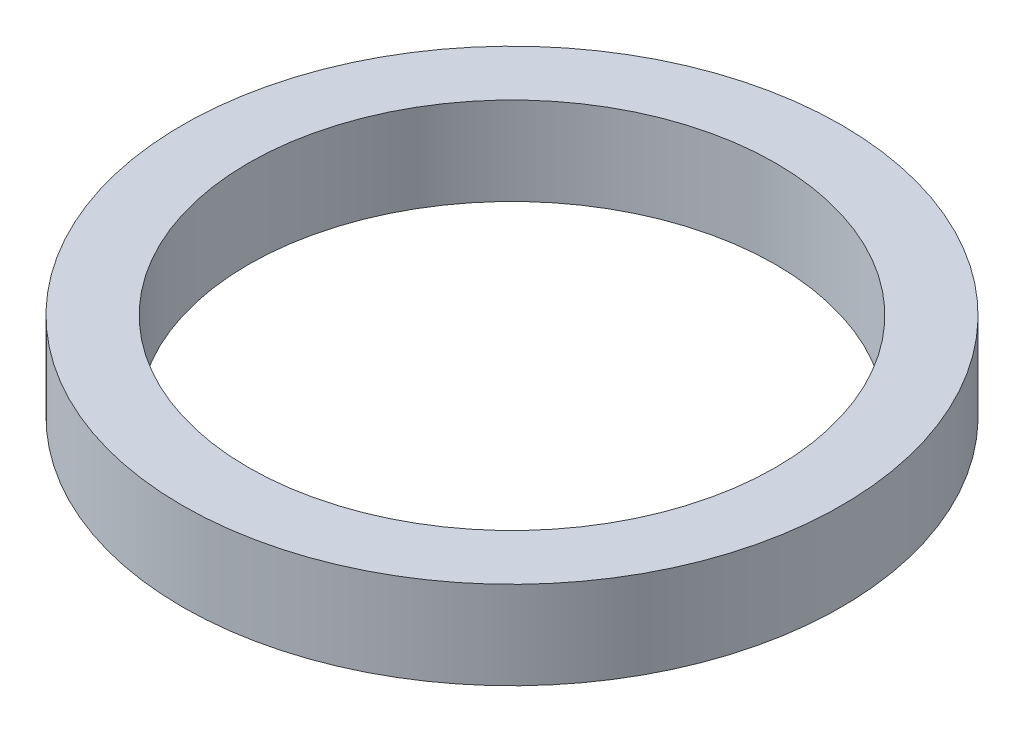
from build123d import *

# Parameters (mm, degrees)
SKETCH1_R           = 7.5
SKETCH1_R_2         = 6
BOSS_EXTRUDE1_DEPTH = 2


with BuildPart() as part:
    # Sketch1 → Boss-Extrude1 (new body)
    with BuildSketch(Plane(origin=(0, 0, 0), x_dir=(1, 0, 0), z_dir=(0, 1, 0))):
        Circle(SKETCH1_R)
        Circle(SKETCH1_R_2, mode=Mode.SUBTRACT)
    extrude(amount=BOSS_EXTRUDE1_DEPTH)


solid = part.part
